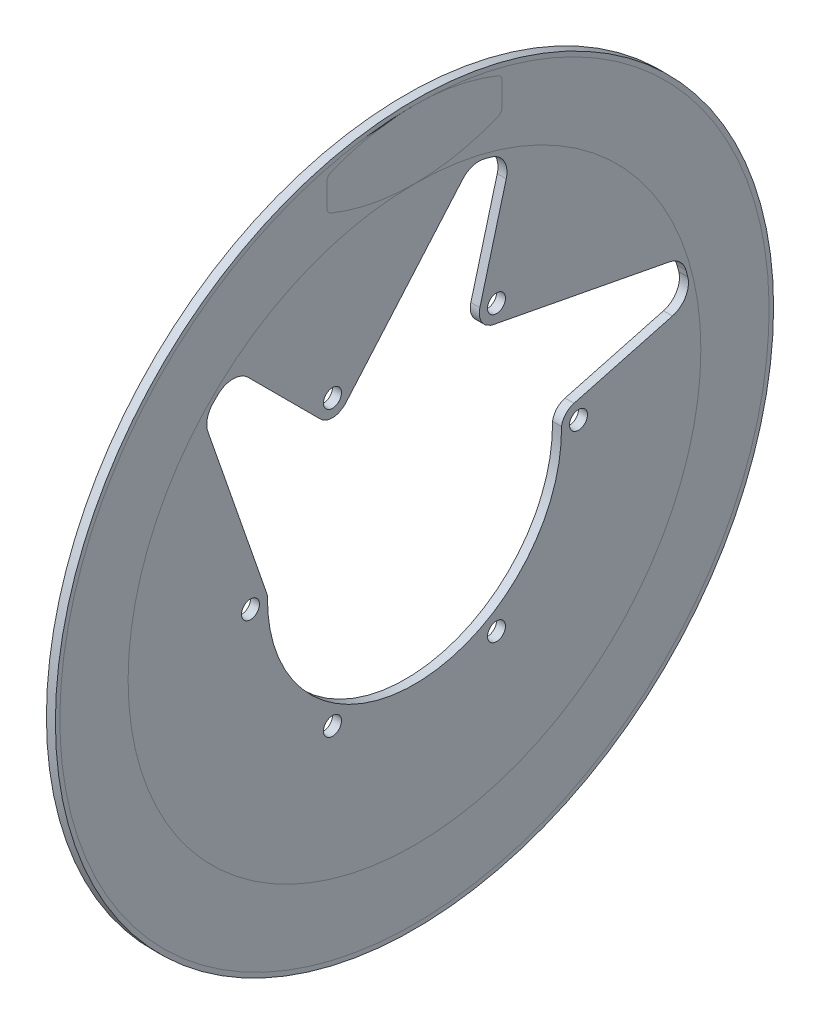
from build123d import *

# Parameters (mm, degrees)
SKETCH1_R           = 127
SKETCH1_R_2         = 3.175
BOSS_EXTRUDE1_DEPTH = 3.175


with BuildPart() as part:
    # Sketch1 → Boss-Extrude1 (new body)
    with BuildSketch(Plane(origin=(0, 0, 0), x_dir=(0, 0, -1), z_dir=(1, 0, 0))):
        Circle(SKETCH1_R)
        with Locations((-29, -50.229473419)):
            Circle(SKETCH1_R_2, mode=Mode.SUBTRACT)
        with Locations((29, -50.229473419)):
            Circle(SKETCH1_R_2, mode=Mode.SUBTRACT)
        with Locations((-58, 0)):
            Circle(SKETCH1_R_2, mode=Mode.SUBTRACT)
        with Locations((-29, 50.229473419)):
            Circle(SKETCH1_R_2, mode=Mode.SUBTRACT)
        with BuildLine():
            ThreePointArc((26.878591102, 44.514507078), (27.360561816, 44.35806316), (27.853860451, 44.242188548))
            Line((27.853860451, 44.242188548), (90.09265644, 32.327882294))
            ThreePointArc((90.09265644, 32.327882294), (93.816961605, 30.453585595), (95.997359825, 26.899812856))
            ThreePointArc((95.997359825, 26.899812856), (96.332243135, 25.674733835), (96.651493171, 24.44548819))
            ThreePointArc((96.651493171, 24.44548819), (95.836263955, 18.720711272), (91.23631902, 15.216688437))
            Line((91.23631902, 15.216688437), (56.422239101, 5.888283837))
            ThreePointArc((56.422239101, 5.888283837), (53.492460577, 4.104059497), (51.989989517, 1.020289173))
            ThreePointArc((51.989989517, 1.020289173), (51.997497319, 0.51016914), (52, 0))
            ThreePointArc((52, 0), (-0.51016914, -51.997497319), (-51.989989517, 1.020289173))
            ThreePointArc((-51.989989517, 1.020289173), (-52.095490467, 1.515910015), (-52.241789427, 2.00105647))
            Line((-52.241789427, 2.00105647), (-73.043095537, 61.858588025))
            ThreePointArc((-73.043095537, 61.858588025), (-73.282059564, 66.021079258), (-71.294601203, 69.686245876))
            ThreePointArc((-71.294601203, 69.686245876), (-70.401093304, 70.588802841), (-69.496160366, 71.479904304))
            ThreePointArc((-69.496160366, 71.479904304), (-64.130743516, 73.636283552), (-58.796198258, 71.404625801))
            Line((-58.796198258, 71.404625801), (-33.310522938, 45.918950481))
            ThreePointArc((-33.310522938, 45.918950481), (-30.300450072, 44.273800023), (-26.878591102, 44.514507078))
            ThreePointArc((-26.878591102, 44.514507078), (-26, 45.033320997), (-25.111398415, 45.534796251))
            ThreePointArc((-25.111398415, 45.534796251), (-24.734928651, 45.873973174), (-24.387928976, 46.243245018))
            Line((-24.387928976, 46.243245018), (17.049560903, 94.186470319))
            ThreePointArc((17.049560903, 94.186470319), (20.534902041, 96.474664853), (24.702758622, 96.586058732))
            ThreePointArc((24.702758622, 96.586058732), (25.931149831, 96.263536676), (27.155332805, 95.925392495))
            ThreePointArc((27.155332805, 95.925392495), (31.705520439, 92.356994825), (32.440120763, 86.621314238))
            Line((32.440120763, 86.621314238), (23.111716163, 51.807234318))
            ThreePointArc((23.111716163, 51.807234318), (23.192010506, 48.377859519), (25.111398415, 45.534796251))
            ThreePointArc((25.111398415, 45.534796251), (26, 45.033320997), (26.878591102, 44.514507078))
        make_face(mode=Mode.SUBTRACT)
        with Locations((58, 0)):
            Circle(SKETCH1_R_2, mode=Mode.SUBTRACT)
        with Locations((29, 50.229473419)):
            Circle(SKETCH1_R_2, mode=Mode.SUBTRACT)
    extrude(amount=BOSS_EXTRUDE1_DEPTH)


solid = part.part
